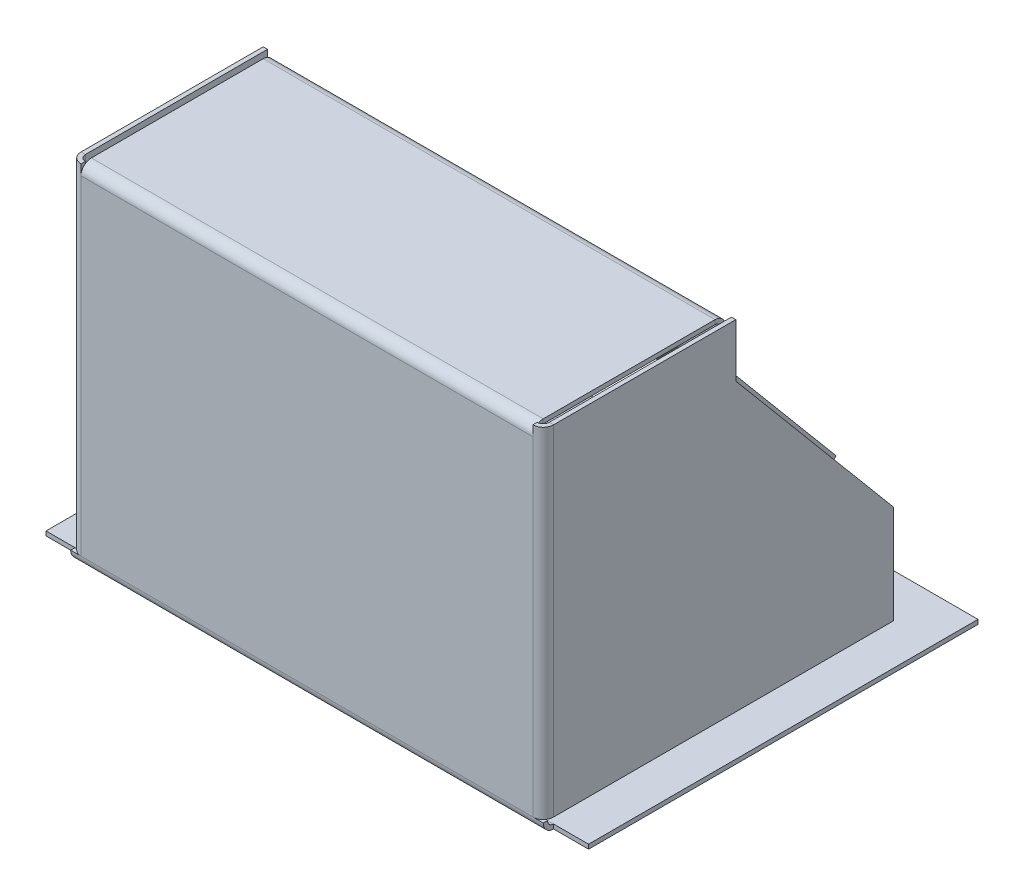
from build123d import *

# Parameters (mm, degrees)
SKETCH1_W                      = 155
SKETCH1_H                      = 100
BASE_FLANGE2_DEPTH             = 1.245
EDGE_FLANGE3_STRIP_W           = 8.4
EDGE_FLANGE3_STRIP_H           = 1.245
EDGE_FLANGE3_STRIP_CUT_DEPTH   = 155
EDGE_FLANGE3_DEPTH             = 155
CUT_EXTRUDE2_START             = -1.245
CUT_EXTRUDE2_OUTLINE_W         = 10
CUT_EXTRUDE2_OUTLINE_H         = 102
CUT_EXTRUDE2_DEPTH             = 2.955
EDGE_FLANGE4_STRIP_W           = 8.4
EDGE_FLANGE4_STRIP_H           = 1.245
EDGE_FLANGE4_STRIP_CUT_DEPTH   = 97.045
EDGE_FLANGE4_STRIP_2_W         = 8.4
EDGE_FLANGE4_STRIP_2_H         = 1.245
EDGE_FLANGE4_STRIP_CUT_2_DEPTH = 97.045
EDGE_FLANGE4_DEPTH             = 97.045
EDGE_FLANGE4_BEND_DEPTH        = 97.045
EDGE_FLANGE5_STRIP_W           = 8.4
EDGE_FLANGE5_STRIP_H           = 1.245
EDGE_FLANGE5_STRIP_CUT_DEPTH   = 129.09
EDGE_FLANGE5_DEPTH             = 129.09
CUT_EXTRUDE3_DEPTH             = 192.224057064
EDGE_FLANGE6_STRIP_W           = 8.4
EDGE_FLANGE6_STRIP_H           = 1.245
EDGE_FLANGE6_STRIP_CUT_DEPTH   = 129.09
EDGE_FLANGE6_DEPTH             = 129.09
EDGE_FLANGE7_START             = -64.545
EDGE_FLANGE7_DEPTH             = 129.09
EDGE_FLANGE7_2_DEPTH           = 129.09


# Read off the part's stored shape, not the designer's step: Cut-Extrude2, Edge-Flange7
# Sheet-metal steps are written as plain solids
with BuildPart() as part:
    # Sketch1 → Base-Flange2 (new body)
    with BuildSketch(Plane.XY):
        Rectangle(SKETCH1_W, SKETCH1_H)
    extrude(amount=-BASE_FLANGE2_DEPTH)

    # Edge-Flange3 strip (across the edge) → Edge-Flange3 strip cut (cut)
    with BuildSketch(Plane(origin=(77.5, -50, -1.245), x_dir=(0, 1, 0), z_dir=(-1, 0, 0))):
        with Locations((-1.245, -0.6225)):
            Rectangle(EDGE_FLANGE3_STRIP_W, EDGE_FLANGE3_STRIP_H)
    extrude(amount=EDGE_FLANGE3_STRIP_CUT_DEPTH, mode=Mode.SUBTRACT)

    # Edge-Flange3 section (across the edge) → Edge-Flange3 (add)
    with BuildSketch(Plane(origin=(77.5, -50, -1.245), x_dir=(0, 1, 0), z_dir=(-1, 0, 0))):
        with BuildLine():
            Line((0, 1.71), (0, 112.955))
            Line((0, 112.955), (1.245, 112.955))
            Line((1.245, 112.955), (1.245, 1.71))
            ThreePointArc((1.245, 1.71), (1.745847404, 0.500847404), (2.955, 0))
            Line((2.955, 0), (2.955, -1.245))
            ThreePointArc((2.955, -1.245), (0.865499462, -0.379500538), (0, 1.71))
        make_face()
    extrude(amount=EDGE_FLANGE3_DEPTH)

    # Cut-Extrude2 outline → Cut-Extrude2 (cut)
    with BuildSketch(Plane(origin=(0, 0, -1.245), x_dir=(-1, 0, 0), z_dir=(0, 0, -1)).offset(CUT_EXTRUDE2_START)):
        with Locations((72.5, 0)):
            Rectangle(CUT_EXTRUDE2_OUTLINE_W, CUT_EXTRUDE2_OUTLINE_H)
        with Locations((-72.5, 0)):
            Rectangle(CUT_EXTRUDE2_OUTLINE_W, CUT_EXTRUDE2_OUTLINE_H)
    extrude(amount=CUT_EXTRUDE2_DEPTH, mode=Mode.SUBTRACT)

    # Edge-Flange4 strip (across the edge) → Edge-Flange4 strip cut (cut)
    with BuildSketch(Plane(origin=(67.5, 50, -1.245), x_dir=(-1, 0, 0), z_dir=(0, -1, 0))):
        with Locations((-1.245, -0.6225)):
            Rectangle(EDGE_FLANGE4_STRIP_W, EDGE_FLANGE4_STRIP_H)
    extrude(amount=EDGE_FLANGE4_STRIP_CUT_DEPTH, mode=Mode.SUBTRACT)

    # Edge-Flange4 strip 2 (across the edge) → Edge-Flange4 strip cut 2 (cut)
    with BuildSketch(Plane(origin=(-67.5, -47.045, -1.245), x_dir=(1, 0, 0), z_dir=(0, 1, 0))):
        with Locations((-1.245, -0.6225)):
            Rectangle(EDGE_FLANGE4_STRIP_2_W, EDGE_FLANGE4_STRIP_2_H)
    extrude(amount=EDGE_FLANGE4_STRIP_CUT_2_DEPTH, mode=Mode.SUBTRACT)

    # Edge-Flange4 section (across the edge) → Edge-Flange4 (add)
    with BuildSketch(Plane(origin=(67.5, 50, -1.245), x_dir=(-1, 0, 0), z_dir=(0, -1, 0))):
        with BuildLine():
            Line((0, 1.71), (0, 98.755))
            Line((0, 98.755), (1.245, 98.755))
            Line((1.245, 98.755), (1.245, 1.71))
            ThreePointArc((1.245, 1.71), (1.745847404, 0.500847404), (2.955, 0))
            Line((2.955, 0), (2.955, -1.245))
            ThreePointArc((2.955, -1.245), (0.865499462, -0.379500538), (0, 1.71))
        make_face()
    extrude(amount=EDGE_FLANGE4_DEPTH)

    # Edge-Flange4 section 2 (across the edge) → Edge-Flange4 bend (add)
    with BuildSketch(Plane(origin=(-67.5, -47.045, -1.245), x_dir=(1, 0, 0), z_dir=(0, 1, 0))):
        with BuildLine():
            Line((0, 1.71), (0, 98.755))
            Line((0, 98.755), (1.245, 98.755))
            Line((1.245, 98.755), (1.245, 1.71))
            ThreePointArc((1.245, 1.71), (1.745847404, 0.500847404), (2.955, 0))
            Line((2.955, 0), (2.955, -1.245))
            ThreePointArc((2.955, -1.245), (0.865499462, -0.379500538), (0, 1.71))
        make_face()
    extrude(amount=EDGE_FLANGE4_BEND_DEPTH)

    # Edge-Flange5 strip (across the edge) → Edge-Flange5 strip cut (cut)
    with BuildSketch(Plane(origin=(-64.545, 50, -1.245), x_dir=(0, -1, 0), z_dir=(1, 0, 0))):
        with Locations((-1.245, -0.6225)):
            Rectangle(EDGE_FLANGE5_STRIP_W, EDGE_FLANGE5_STRIP_H)
    extrude(amount=EDGE_FLANGE5_STRIP_CUT_DEPTH, mode=Mode.SUBTRACT)

    # Edge-Flange5 section (across the edge) → Edge-Flange5 (add)
    with BuildSketch(Plane(origin=(-64.545, 50, -1.245), x_dir=(0, -1, 0), z_dir=(1, 0, 0))):
        with BuildLine():
            Line((0, 1.71), (0, 53.755))
            Line((0, 53.755), (1.245, 53.755))
            Line((1.245, 53.755), (1.245, 1.71))
            ThreePointArc((1.245, 1.71), (1.745847404, 0.500847404), (2.955, 0))
            Line((2.955, 0), (2.955, -1.245))
            ThreePointArc((2.955, -1.245), (0.865499462, -0.379500538), (0, 1.71))
        make_face()
    extrude(amount=EDGE_FLANGE5_DEPTH)

    # Sketch26 → Cut-Extrude3 (cut, through all)
    with BuildSketch(Plane(origin=(67.5, 0, 0), x_dir=(0, 0, -1), z_dir=(1, 0, 0))):
        Polygon((55, 50), (55, 34.789940387), (100, -18.83897128), (100, 50), align=None)
    extrude(amount=-CUT_EXTRUDE3_DEPTH, mode=Mode.SUBTRACT)

    # Edge-Flange6 strip (across the edge) → Edge-Flange6 strip cut (cut)
    with BuildSketch(Plane(origin=(-64.545, 48.755, -55), x_dir=(0, 0, 1), z_dir=(1, 0, 0))):
        with Locations((-1.245, -0.6225)):
            Rectangle(EDGE_FLANGE6_STRIP_W, EDGE_FLANGE6_STRIP_H)
    extrude(amount=EDGE_FLANGE6_STRIP_CUT_DEPTH, mode=Mode.SUBTRACT)

    # Edge-Flange6 section (across the edge) → Edge-Flange6 (add)
    with BuildSketch(Plane(origin=(-64.545, 48.755, -55), x_dir=(0, 0, 1), z_dir=(1, 0, 0))):
        with BuildLine():
            Line((0, 1.71), (0, 13.965059613))
            Line((0, 13.965059613), (1.245, 13.965059613))
            Line((1.245, 13.965059613), (1.245, 1.71))
            ThreePointArc((1.245, 1.71), (1.745847404, 0.500847404), (2.955, 0))
            Line((2.955, 0), (2.955, -1.245))
            ThreePointArc((2.955, -1.245), (0.865499462, -0.379500538), (0, 1.71))
        make_face()
    extrude(amount=EDGE_FLANGE6_DEPTH)

    # Edge-Flange7 outline → Edge-Flange7 (cut)
    with BuildSketch(Plane.YZ.offset(EDGE_FLANGE7_START)):
        with BuildLine():
            Line((34.789940387, -55), (35.449768265, -54.446338671))
            ThreePointArc((35.449768265, -54.446338671), (36.338536128, -53.933208306), (37.349205652, -53.755))
            Line((37.349205652, -53.755), (34.789940387, -53.755))
            Line((34.789940387, -53.755), (34.789940387, -55))
        make_face()
    extrude(amount=EDGE_FLANGE7_DEPTH, mode=Mode.SUBTRACT)

    # Edge-Flange7 2 outline → Edge-Flange7 2 (add)
    with BuildSketch(Plane.YZ.offset(EDGE_FLANGE7_START)):
        with BuildLine():
            Line((37.349205652, -55), (34.789940387, -55))
            Line((34.789940387, -55), (-1.798735213, -85.701544201))
            Line((-1.798735213, -85.701544201), (-0.998464639, -86.655269533))
            Line((-0.998464639, -86.655269533), (36.250038839, -55.400064002))
            ThreePointArc((36.250038839, -55.400064002), (36.764351207, -55.103125618), (37.349205652, -55))
        make_face()
    extrude(amount=EDGE_FLANGE7_2_DEPTH)


solid = part.part
